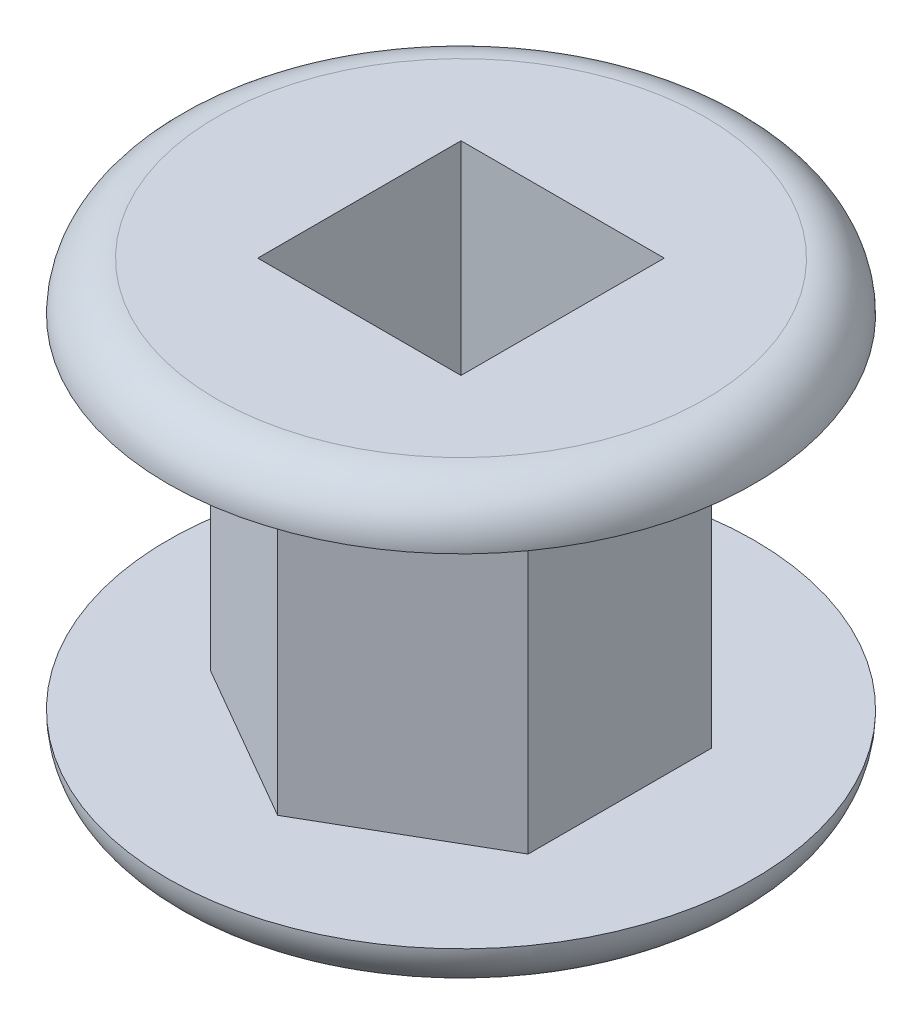
from build123d import *

# Parameters (mm, degrees)
BOSS_EXTRUDE1_DEPTH = 6.35
SKETCH2_R           = 9.525
BOSS_EXTRUDE2_DEPTH = 0.79375
SKETCH3_W           = 6.604
SKETCH3_H           = 6.604
CUT_EXTRUDE1_DEPTH  = 20.636290542
FILLET1_R           = 1.5875


with BuildPart() as part:
    # Sketch1 → Boss-Extrude1 (new, symmetric)
    with BuildSketch(Plane(origin=(0, 0, 0), x_dir=(1, 0, 0), z_dir=(0, 1, 0))):
        Polygon((0, 5.95753309), (-5.159375, 2.978766545), (-5.159375, -2.978766545), (0, -5.95753309), (5.159375, -2.978766545), (5.159375, 2.978766545), align=None)
    extrude(amount=BOSS_EXTRUDE1_DEPTH, both=True)

    # Sketch2 → Boss-Extrude2 (add, symmetric)
    with BuildSketch(Plane(origin=(0, 6.35, 0), x_dir=(1, 0, 0), z_dir=(0, 1, 0))):
        with Locations(Location((0, 0, 0), (0, 0, 270))):
            Circle(SKETCH2_R)
    boss_extrude2 = extrude(amount=BOSS_EXTRUDE2_DEPTH, both=True)

    # Mirror1: Boss-Extrude2 across plane
    add(boss_extrude2.mirror(Plane.ZX))

    # Sketch3 → Cut-Extrude1 (cut, through all)
    with BuildSketch(Plane(origin=(0, 7.14375, 0), x_dir=(1, 0, 0), z_dir=(0, 1, 0))):
        Rectangle(SKETCH3_W, SKETCH3_H)
    extrude(amount=-CUT_EXTRUDE1_DEPTH, mode=Mode.SUBTRACT)

    # Fillet1
    fillet1_edges = [part.edges().sort_by_distance(p)[0] for p in [
        (0, 7.14375, -9.525),
        (0, -7.14375, -9.525),
    ]]
    fillet(fillet1_edges, radius=FILLET1_R - 0.0001)  # a hair under: the kernel refuses the full size


solid = part.part
